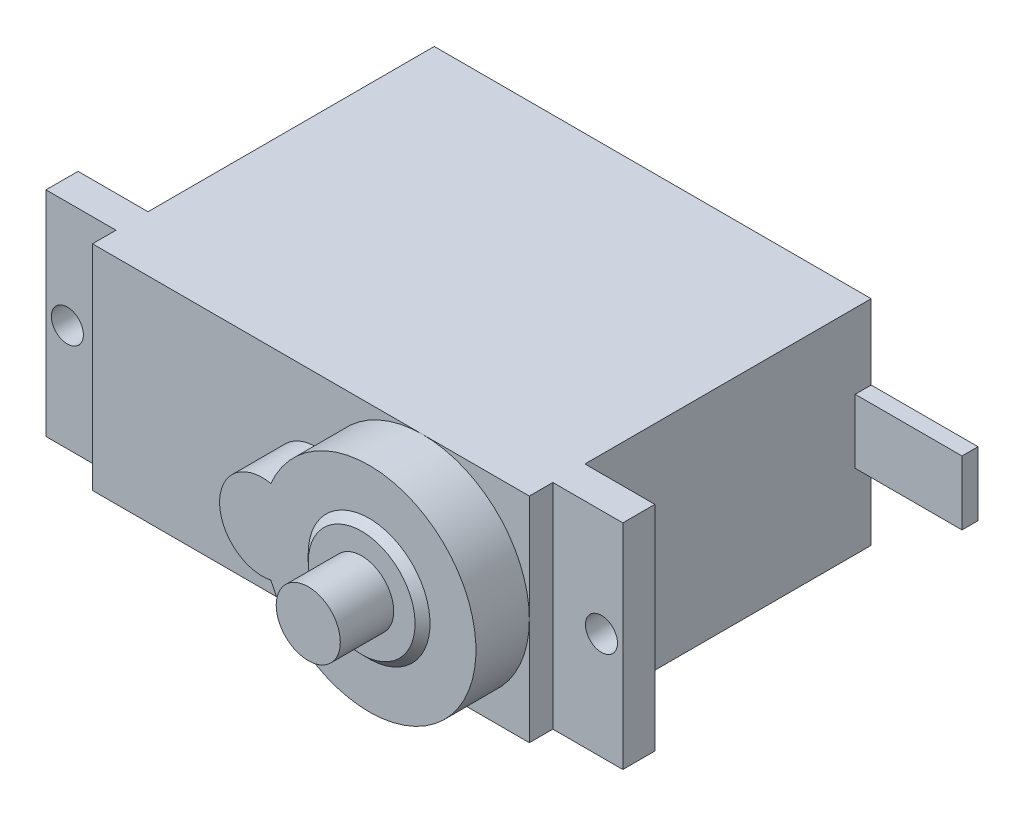
from build123d import *

# Parameters (mm, degrees)
SKETCH3_R           = 3
BOSS_EXTRUDE1_DEPTH = 2.5
SKETCH4_R           = 6
BOSS_EXTRUDE2_DEPTH = 0.7
BOSS_EXTRUDE3_DEPTH = 5
SKETCH6_W           = 40.9
SKETCH6_H           = 20
BOSS_EXTRUDE4_DEPTH = 32
SKETCH7_W           = 3
SKETCH7_H           = 20
BOSS_EXTRUDE5_DEPTH = 20
SKETCH8_OUTSIDE_W   = 101.628
SKETCH8_OUTSIDE_H   = 40.728
SKETCH8_OUTSIDE_W_2 = 54
SKETCH8_OUTSIDE_H_2 = 30
CUT_EXTRUDE1_DEPTH  = 66.626595219
CUT_EXTRUDE2_REACH  = 50.893
SKETCH10_R          = 1.5
SKETCH11_W          = 1.5
SKETCH11_H          = 6
BOSS_EXTRUDE6_DEPTH = 10
CHAMFER1_SIZE       = 1


with BuildPart() as part:
    # Sketch3 → Boss-Extrude1 (new, symmetric)
    with BuildSketch(Plane.XY):
        Circle(SKETCH3_R)
    extrude(amount=BOSS_EXTRUDE1_DEPTH, both=True)

    # Sketch4 → Boss-Extrude2 (add)
    with BuildSketch(Plane(origin=(0, 0, -2.5), x_dir=(-1, 0, 0), z_dir=(0, 0, -1))):
        Circle(SKETCH4_R)
    extrude(amount=BOSS_EXTRUDE2_DEPTH)

    # Sketch5 → Boss-Extrude3 (add)
    with BuildSketch(Plane(origin=(0, 0, -3.2), x_dir=(-1, 0, 0), z_dir=(0, 0, -1))):
        with BuildLine():
            ThreePointArc((9.2, 3.919183588), (-10, 0), (9.2, -3.919183588))
            ThreePointArc((9.2, -3.919183588), (14, 0), (9.2, 3.919183588))
        make_face()
    extrude(amount=BOSS_EXTRUDE3_DEPTH)

    # Sketch6 → Boss-Extrude4 (add)
    with BuildSketch(Plane(origin=(0, 0, -8.2), x_dir=(-1, 0, 0), z_dir=(0, 0, -1))):
        with Locations((10.45, 0)):
            Rectangle(SKETCH6_W, SKETCH6_H)
    extrude(amount=BOSS_EXTRUDE4_DEPTH)

    # Sketch7 → Boss-Extrude5 (add)
    with BuildSketch(Plane(origin=(10, 0, 0), x_dir=(0, 0, -1), z_dir=(1, 0, 0))):
        with Locations((11.9, 0)):
            Rectangle(SKETCH7_W, SKETCH7_H)
    boss_extrude5 = extrude(amount=BOSS_EXTRUDE5_DEPTH)

    # Mirror1: Boss-Extrude5 across plane
    add(boss_extrude5.mirror(Plane(origin=(-10.45, 0, 0), x_dir=(0, 0, 1), z_dir=(1, 0, 0))))

    # Sketch8 outside → Cut-Extrude1 (cut, through all)
    with BuildSketch(Plane.XY):
        with Locations((-10.45, 0)):
            Rectangle(SKETCH8_OUTSIDE_W, SKETCH8_OUTSIDE_H)
        with Locations((-10.45, 0)):
            Rectangle(SKETCH8_OUTSIDE_W_2, SKETCH8_OUTSIDE_H_2, mode=Mode.SUBTRACT)
    extrude(amount=-CUT_EXTRUDE1_DEPTH, mode=Mode.SUBTRACT)

    # Sketch10 → Cut-Extrude2 (cut, up to next)
    with BuildSketch(Plane.XY.offset(-10.4), mode=Mode.PRIVATE) as cut_extrude2_sk1:
        with Locations((-35.45, 0)):
            Circle(SKETCH10_R)
    cut_extrude2_tool1 = extrude(cut_extrude2_sk1.sketch, amount=-CUT_EXTRUDE2_REACH, mode=Mode.PRIVATE) & part.part
    # Sketch10 → Cut-Extrude2 (cut, up to next)
    with BuildSketch(Plane.XY.offset(-10.4), mode=Mode.PRIVATE) as cut_extrude2_sk2:
        with Locations(Location((14.55, 0, 0), (0, 0, 270))):
            Circle(SKETCH10_R)
    cut_extrude2_tool2 = extrude(cut_extrude2_sk2.sketch, amount=-CUT_EXTRUDE2_REACH, mode=Mode.PRIVATE) & part.part
    add(cut_extrude2_tool1.solids().sort_by_distance((-35.45, 0, -10.4))[0], mode=Mode.SUBTRACT)
    add(cut_extrude2_tool2.solids().sort_by_distance((14.55, 0, -10.4))[0], mode=Mode.SUBTRACT)

    # Sketch11 → Boss-Extrude6 (add)
    with BuildSketch(Plane(origin=(10, 0, 0), x_dir=(0, 0, -1), z_dir=(1, 0, 0))):
        with Locations((39.45, 0)):
            Rectangle(SKETCH11_W, SKETCH11_H)
    extrude(amount=BOSS_EXTRUDE6_DEPTH)

    # Chamfer1
    # the kernel refuses this chamfer: 1 mm, written as the material it takes off along each edge
    with BuildSketch(Plane(origin=(0, 0, -2.5), x_dir=(-1, 0, 0), z_dir=(0, -1, 0))) as chamfer1_piece_1_section:
        Polygon((6, CHAMFER1_SIZE), (6 - CHAMFER1_SIZE, 0), (6, 0), align=None)
    chamfer1_piece_1 = revolve(axis=Axis((0, 0, -2.5), (0, 0, -1)), mode=Mode.PRIVATE)
    chamfer1_piece_1 = split(chamfer1_piece_1, bisect_by=Plane(origin=(5.354214233, 0, -3.2), z_dir=(0, 0, 1)), keep=Keep.TOP, mode=Mode.PRIVATE)
    add(chamfer1_piece_1, mode=Mode.SUBTRACT)


solid = part.part
